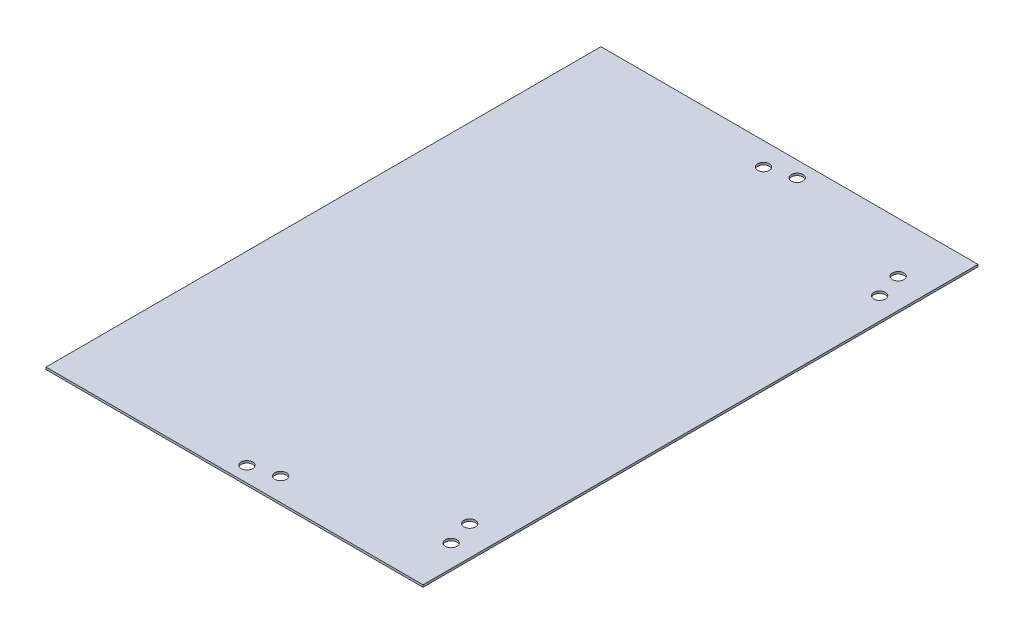
from build123d import *

# Parameters (mm, degrees)
SKETCH3_W           = 220
SKETCH3_H           = 323.8
BOSS_EXTRUDE1_DEPTH = 1.2954
CUT_EXTRUDE1_REACH  = 197.738
SKETCH4_R           = 3.3782


with BuildPart() as part:
    # Sketch3 → Boss-Extrude1 (new body)
    with BuildSketch(Plane(origin=(0, 0, 0), x_dir=(1, 0, 0), z_dir=(0, 1, 0))):
        Rectangle(SKETCH3_W, SKETCH3_H)
    extrude(amount=BOSS_EXTRUDE1_DEPTH)

    # Sketch4 → Cut-Extrude1 (cut, up to next)
    with BuildSketch(Plane(origin=(0, 1.2954, 0), x_dir=(1, 0, 0), z_dir=(0, 1, 0)), mode=Mode.PRIVATE) as cut_extrude1_sk1:
        with Locations((97.1046, -132.62)):
            Circle(SKETCH4_R)
    cut_extrude1_tool1 = extrude(cut_extrude1_sk1.sketch, amount=-CUT_EXTRUDE1_REACH, mode=Mode.PRIVATE) & part.part
    # Sketch4 → Cut-Extrude1 (cut, up to next)
    with BuildSketch(Plane(origin=(0, 1.2954, 0), x_dir=(1, 0, 0), z_dir=(0, 1, 0)), mode=Mode.PRIVATE) as cut_extrude1_sk2:
        with Locations((92.7046, -117.38)):
            Circle(SKETCH4_R)
    cut_extrude1_tool2 = extrude(cut_extrude1_sk2.sketch, amount=-CUT_EXTRUDE1_REACH, mode=Mode.PRIVATE) & part.part
    # Sketch4 → Cut-Extrude1 (cut, up to next)
    with BuildSketch(Plane(origin=(0, 1.2954, 0), x_dir=(1, 0, 0), z_dir=(0, 1, 0)), mode=Mode.PRIVATE) as cut_extrude1_sk3:
        with Locations((13.4996, -148.5)):
            Circle(SKETCH4_R)
    cut_extrude1_tool3 = extrude(cut_extrude1_sk3.sketch, amount=-CUT_EXTRUDE1_REACH, mode=Mode.PRIVATE) & part.part
    # Sketch4 → Cut-Extrude1 (cut, up to next)
    with BuildSketch(Plane(origin=(0, 1.2954, 0), x_dir=(1, 0, 0), z_dir=(0, 1, 0)), mode=Mode.PRIVATE) as cut_extrude1_sk4:
        with Locations((-1.7404, -152.9)):
            Circle(SKETCH4_R)
    cut_extrude1_tool4 = extrude(cut_extrude1_sk4.sketch, amount=-CUT_EXTRUDE1_REACH, mode=Mode.PRIVATE) & part.part
    # Sketch4 → Cut-Extrude1 (cut, up to next)
    with BuildSketch(Plane(origin=(0, 1.2954, 0), x_dir=(1, 0, 0), z_dir=(0, 1, 0)), mode=Mode.PRIVATE) as cut_extrude1_sk5:
        with Locations((97.1046, 117.38)):
            Circle(SKETCH4_R)
    cut_extrude1_tool5 = extrude(cut_extrude1_sk5.sketch, amount=-CUT_EXTRUDE1_REACH, mode=Mode.PRIVATE) & part.part
    # Sketch4 → Cut-Extrude1 (cut, up to next)
    with BuildSketch(Plane(origin=(0, 1.2954, 0), x_dir=(1, 0, 0), z_dir=(0, 1, 0)), mode=Mode.PRIVATE) as cut_extrude1_sk6:
        with Locations((92.7046, 132.62)):
            Circle(SKETCH4_R)
    cut_extrude1_tool6 = extrude(cut_extrude1_sk6.sketch, amount=-CUT_EXTRUDE1_REACH, mode=Mode.PRIVATE) & part.part
    # Sketch4 → Cut-Extrude1 (cut, up to next)
    with BuildSketch(Plane(origin=(0, 1.2954, 0), x_dir=(1, 0, 0), z_dir=(0, 1, 0)), mode=Mode.PRIVATE) as cut_extrude1_sk7:
        with Locations((13.4996, 152.9)):
            Circle(SKETCH4_R)
    cut_extrude1_tool7 = extrude(cut_extrude1_sk7.sketch, amount=-CUT_EXTRUDE1_REACH, mode=Mode.PRIVATE) & part.part
    # Sketch4 → Cut-Extrude1 (cut, up to next)
    with BuildSketch(Plane(origin=(0, 1.2954, 0), x_dir=(1, 0, 0), z_dir=(0, 1, 0)), mode=Mode.PRIVATE) as cut_extrude1_sk8:
        with Locations((-1.7404, 148.5)):
            Circle(SKETCH4_R)
    cut_extrude1_tool8 = extrude(cut_extrude1_sk8.sketch, amount=-CUT_EXTRUDE1_REACH, mode=Mode.PRIVATE) & part.part
    add(cut_extrude1_tool1.solids().sort_by_distance((97.1046, 1.2954, 132.62))[0], mode=Mode.SUBTRACT)
    add(cut_extrude1_tool2.solids().sort_by_distance((92.7046, 1.2954, 117.38))[0], mode=Mode.SUBTRACT)
    add(cut_extrude1_tool3.solids().sort_by_distance((13.4996, 1.2954, 148.5))[0], mode=Mode.SUBTRACT)
    add(cut_extrude1_tool4.solids().sort_by_distance((-1.7404, 1.2954, 152.9))[0], mode=Mode.SUBTRACT)
    add(cut_extrude1_tool5.solids().sort_by_distance((97.1046, 1.2954, -117.38))[0], mode=Mode.SUBTRACT)
    add(cut_extrude1_tool6.solids().sort_by_distance((92.7046, 1.2954, -132.62))[0], mode=Mode.SUBTRACT)
    add(cut_extrude1_tool7.solids().sort_by_distance((13.4996, 1.2954, -152.9))[0], mode=Mode.SUBTRACT)
    add(cut_extrude1_tool8.solids().sort_by_distance((-1.7404, 1.2954, -148.5))[0], mode=Mode.SUBTRACT)


solid = part.part
